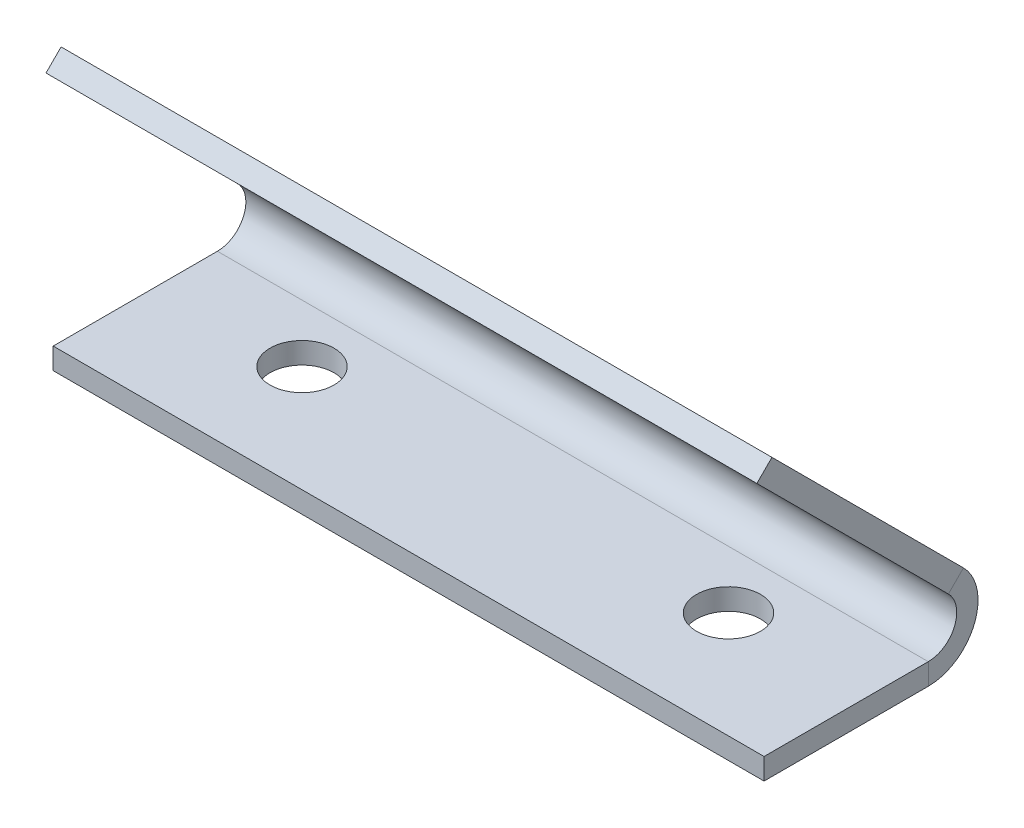
from build123d import *

# Parameters (mm, degrees)
BOSS_EXTRUDE1_DEPTH    = 25
CUT_EXTRUDE1_REACH     = 37.102
SKETCH2_R              = 2.25
CUT_EXTRUDE2_REACH     = 37.892
SKETCH3_R              = 2.25
CONVERT_SOLID1_START   = -25
CONVERT_SOLID1_DEPTH   = 50
CONVERT_SOLID1_2_DEPTH = 50


# Read off the part's stored shape, not the designer's step: Convert-Solid1
with BuildPart() as part:
    # Sketch1 → Boss-Extrude1 (new, symmetric)
    with BuildSketch(Plane(origin=(0, 0, 0), x_dir=(0, 0, -1), z_dir=(1, 0, 0))):
        Polygon((0, 0), (-16.884776311, 16.884776311), (-15.824116139, 17.945436483), (3.621320344, -1.5), (-16.378679656, -1.5), (-16.378679656, 0), align=None)
    extrude(amount=BOSS_EXTRUDE1_DEPTH, both=True)

    # Sketch2 → Cut-Extrude1 (cut, up to next)
    with BuildSketch(Plane(origin=(0, 1.060660172, -1.060660172), x_dir=(1, 0, 0), z_dir=(0, 0.7071067811865513, -0.7071067811865438)), mode=Mode.PRIVATE) as cut_extrude1_sk1:
        with Locations(Location((-15, -16.378679656, 0), (0, 0, 270))):
            Circle(SKETCH2_R)
    cut_extrude1_tool1 = extrude(cut_extrude1_sk1.sketch, amount=-CUT_EXTRUDE1_REACH, mode=Mode.PRIVATE) & part.part
    # Sketch2 → Cut-Extrude1 (cut, up to next)
    with BuildSketch(Plane(origin=(0, 1.060660172, -1.060660172), x_dir=(1, 0, 0), z_dir=(0, 0.7071067811865513, -0.7071067811865438)), mode=Mode.PRIVATE) as cut_extrude1_sk2:
        with Locations(Location((15, -16.378679656, 0), (0, 0, 270))):
            Circle(SKETCH2_R)
    cut_extrude1_tool2 = extrude(cut_extrude1_sk2.sketch, amount=-CUT_EXTRUDE1_REACH, mode=Mode.PRIVATE) & part.part
    add(cut_extrude1_tool1.solids().sort_by_distance((-15, 12.642136, 10.520815))[0], mode=Mode.SUBTRACT)
    add(cut_extrude1_tool2.solids().sort_by_distance((15, 12.642136, 10.520815))[0], mode=Mode.SUBTRACT)

    # Sketch3 → Cut-Extrude2 (cut, up to next)
    with BuildSketch(Plane.XZ.offset(1.5), mode=Mode.PRIVATE) as cut_extrude2_sk1:
        with Locations(Location((-15, 8.878679656, 0), (0, 0, 270))):
            Circle(SKETCH3_R)
    cut_extrude2_tool1 = extrude(cut_extrude2_sk1.sketch, amount=-CUT_EXTRUDE2_REACH, mode=Mode.PRIVATE) & part.part
    # Sketch3 → Cut-Extrude2 (cut, up to next)
    with BuildSketch(Plane.XZ.offset(1.5), mode=Mode.PRIVATE) as cut_extrude2_sk2:
        with Locations(Location((15, 8.878679656, 0), (0, 0, 270))):
            Circle(SKETCH3_R)
    cut_extrude2_tool2 = extrude(cut_extrude2_sk2.sketch, amount=-CUT_EXTRUDE2_REACH, mode=Mode.PRIVATE) & part.part
    add(cut_extrude2_tool1.solids().sort_by_distance((-15, -1.5, 8.87868))[0], mode=Mode.SUBTRACT)
    add(cut_extrude2_tool2.solids().sort_by_distance((15, -1.5, 8.87868))[0], mode=Mode.SUBTRACT)

    # Convert-Solid1 outline → Convert-Solid1 (cut)
    with BuildSketch(Plane.YZ.offset(CONVERT_SOLID1_START)):
        with BuildLine():
            Line((-1.5, -3.621320344), (4.474873734, 2.353553391))
            ThreePointArc((4.474873734, 2.353553391), (3.048097173, 1.489042104), (1.383203961, 1.383203961))
            Line((1.383203961, 1.383203961), (0, 0))
            Line((0, 0), (0, 1.956145802))
            ThreePointArc((0, 1.956145802), (-1.102418412, 3.20824195), (-1.5, 4.828427125))
            Line((-1.5, 4.828427125), (-1.5, -3.621320344))
        make_face()
    extrude(amount=CONVERT_SOLID1_DEPTH, mode=Mode.SUBTRACT)

    # Convert-Solid1 2 outline → Convert-Solid1 2 (add)
    with BuildSketch(Plane.YZ.offset(CONVERT_SOLID1_START)):
        with BuildLine():
            ThreePointArc((0, 1.956145802), (0.660607987, 1.594848761), (1.383203961, 1.383203961))
            Line((1.383203961, 1.383203961), (3.414213562, 3.414213562))
            ThreePointArc((3.414213562, 3.414213562), (1.234633135, 2.98066806), (0, 4.828427125))
            Line((0, 4.828427125), (0, 1.956145802))
        make_face()
    extrude(amount=CONVERT_SOLID1_2_DEPTH)


solid = part.part
